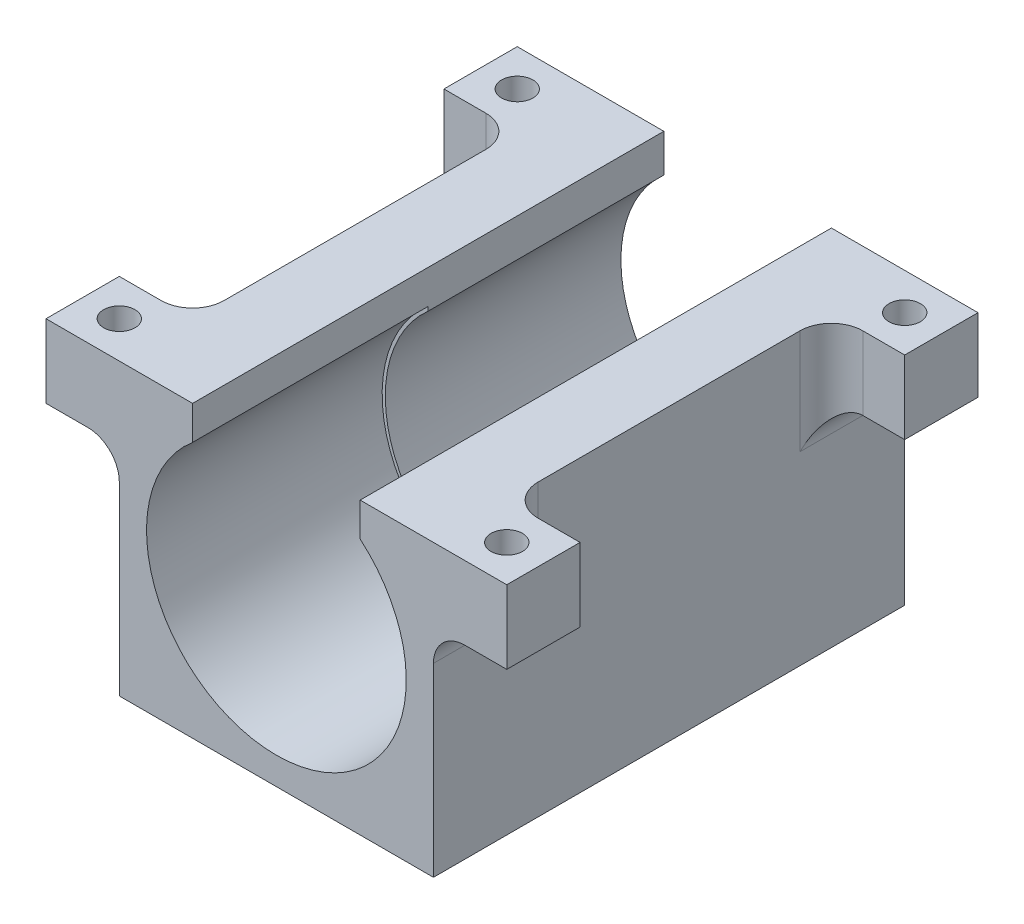
from build123d import *

# Parameters (mm, degrees)
RESSALTO_EXTRUS_O2_DEPTH = 45
CORTE_EXTRUS_O3_DEPTH    = 65.806662735
CORTE_EXTRUS_O6_DEPTH    = 64.577682743
ESBO_O7_R                = 1.5
CORTE_EXTRUS_O7_DEPTH    = 64.577682743
CORTE_EXTRUS_O8_DEPTH    = 65.806662804
ESBO_O9_R                = 12.4
CORTE_EXTRUS_O11_DEPTH   = 22.5


with BuildPart() as part:
    # Esboço1 → Ressalto-extrusão2 (new body)
    with BuildSketch(Plane.XY):
        with BuildLine():
            Line((-28.352959465, -30.41499288), (1.647040535, -30.41499288))
            Line((1.647040535, -30.41499288), (1.647040535, -12.71499288))
            ThreePointArc((1.647040535, -12.71499288), (2.525720192, -10.593672537), (4.647040535, -9.71499288))
            Line((4.647040535, -9.71499288), (8.647040535, -9.71499288))
            Line((8.647040535, -9.71499288), (8.647040535, -2.71499288))
            Line((8.647040535, -2.71499288), (1.647040535, -2.71499288))
            Line((1.647040535, -2.71499288), (-28.352959465, -2.71499288))
            Line((-28.352959465, -2.71499288), (-35.352959465, -2.71499288))
            Line((-35.352959465, -2.71499288), (-35.352959465, -9.71499288))
            Line((-35.352959465, -9.71499288), (-31.352959465, -9.71499288))
            ThreePointArc((-31.352959465, -9.71499288), (-29.231639121, -10.593672537), (-28.352959465, -12.71499288))
            Line((-28.352959465, -12.71499288), (-28.352959465, -30.41499288))
        make_face()
    extrude(amount=RESSALTO_EXTRUS_O2_DEPTH)

    # Esboço5 → Corte-extrusão3 (cut, through all)
    with BuildSketch(Plane.XY.offset(45)):
        Polygon((-21.352959465, -0.463813323), (-21.352959465, -12.641176013), (-5.352959465, -12.641176013), (-5.352959465, -0.463813323), (-13.352959465, -0.463813323), align=None)
    extrude(amount=-CORTE_EXTRUS_O3_DEPTH, mode=Mode.SUBTRACT)

    # Esboço6 → Corte-extrusão6 (cut, through all)
    with BuildSketch(Plane.XZ.offset(30.41499288)):
        with BuildLine():
            ThreePointArc((-28.352959465, 35), (-29.231639121, 37.121320344), (-31.352959465, 38))
            Line((-31.352959465, 38), (-42.841278922, 38))
            Line((-42.841278922, 38), (-44.214216872, 7))
            Line((-44.214216872, 7), (-31.352959465, 7))
            ThreePointArc((-31.352959465, 7), (-29.231639121, 7.878679656), (-28.352959465, 10))
            Line((-28.352959465, 10), (-28.352959465, 35))
        make_face()
        with BuildLine():
            ThreePointArc((4.647040535, 38), (2.525720192, 37.121320344), (1.647040535, 35))
            Line((1.647040535, 35), (1.647040535, 10))
            ThreePointArc((1.647040535, 10), (2.525720192, 7.878679656), (4.647040535, 7))
            Line((4.647040535, 7), (17.448604988, 7))
            Line((17.448604988, 7), (15.120579768, 38))
            Line((15.120579768, 38), (4.647040535, 38))
        make_face()
    extrude(amount=-CORTE_EXTRUS_O6_DEPTH, mode=Mode.SUBTRACT)

    # Esboço7 → Corte-extrusão7 (cut, through all)
    with BuildSketch(Plane(origin=(0, -2.71499288, 0), x_dir=(1, 0, 0), z_dir=(0, 1, 0))):
        with Locations((-31.852959465, -3.5)):
            Circle(ESBO_O7_R)
        with Locations((5.147040535, -3.5)):
            Circle(ESBO_O7_R)
        with Locations((5.147040535, -41.5)):
            Circle(ESBO_O7_R)
        with Locations((-31.852959465, -41.5)):
            Circle(ESBO_O7_R)
    extrude(amount=-CORTE_EXTRUS_O7_DEPTH, mode=Mode.SUBTRACT)

    # Esboço8 → Corte-extrusão8 (cut, through all)
    with BuildSketch(Plane.XY.offset(45)):
        with BuildLine():
            ThreePointArc((-13.352959465, -27.51499288), (-4.796967412, -23.970984933), (-1.252959465, -15.41499288))
            ThreePointArc((-1.252959465, -15.41499288), (-2.325493754, -10.434531054), (-5.352959465, -6.336997507))
            Line((-5.352959465, -6.336997507), (-5.352959465, -12.641176013))
            Line((-5.352959465, -12.641176013), (-21.352959465, -12.641176013))
            Line((-21.352959465, -12.641176013), (-21.352959465, -6.336997507))
            ThreePointArc((-21.352959465, -6.336997507), (-24.672273579, -19.690870333), (-13.352959465, -27.51499288))
        make_face()
    extrude(amount=-CORTE_EXTRUS_O8_DEPTH, mode=Mode.SUBTRACT)

    # Esboço9 → Corte-extrusão11 (cut)
    with BuildSketch(Plane.XY.offset(45)):
        with Locations((-13.352959465, -15.41499288)):
            Circle(ESBO_O9_R)
    extrude(amount=-CORTE_EXTRUS_O11_DEPTH, mode=Mode.SUBTRACT)


solid = part.part
